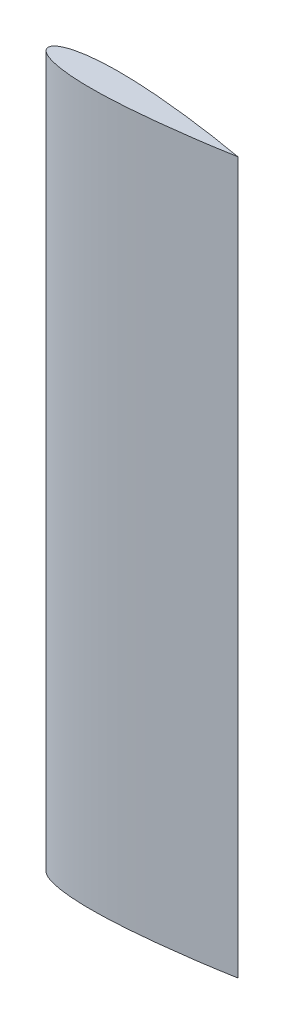
from build123d import *


with BuildPart() as part:
    # rootSketch → Loft1 section 0
    with BuildSketch(Plane(origin=(0, 0, 0), x_dir=(1, 0, 0), z_dir=(0, 1, 0))):
        with BuildLine():
            add(Edge.make_bspline(
                [(0, 0), (-1.6572e-05, 0.056577364), (0.005364667, 0.148026672), (0.026073501, 0.280241396), (0.077769955, 0.452215412), (0.147060273, 0.611874915), (0.248525433, 0.785971359), (0.39236103, 0.977542518), (0.599181982, 1.195423819), (0.905829823, 1.451816919), (1.370469676, 1.757918922), (2.078266075, 2.119108524), (3.175731681, 2.542039428), (4.823252293, 2.99869744), (7.275411011, 3.452976612), (10.438659341, 3.780475746), (14.129329887, 3.929259057), (18.143568779, 3.896250983), (22.151742679, 3.722301475), (25.656241741, 3.475962342), (28.651461505, 3.213566971), (31.650711737, 2.914013348), (34.134157887, 2.639630917), (36.639458817, 2.336640809), (39.599525944, 1.953685828), (42.127939329, 1.60070159), (44.533194308, 1.24753169), (47.121130826, 0.837424538), (48.910319544, 0.545474341), (50.6553202, 0.241362714), (51.550989041, 0.081579679), (52, 0)],
                knots=[0, 0, 0, 0, 0, 0.003840944, 0.006235023, 0.009072291, 0.01219322, 0.015656839, 0.019917177, 0.025338962, 0.032592504, 0.042799388, 0.05770457, 0.079310668, 0.112503101, 0.158972616, 0.227236465, 0.295500326, 0.36376419, 0.432028053, 0.500291915, 0.534423847, 0.56855578, 0.636819643, 0.670951575, 0.705083508, 0.773347371, 0.807479302, 0.841611234, 0.875743167, 0.9098751, 0.9098751, 0.9098751, 0.9098751, 0.9098751], degree=4))
            add(Edge.make_bspline(
                [(0, 0), (-1.6572e-05, -0.056577364), (0.005364667, -0.148026672), (0.026073501, -0.280241396), (0.077769955, -0.452215412), (0.147060273, -0.611874915), (0.248525433, -0.785971359), (0.39236103, -0.977542518), (0.599181982, -1.195423819), (0.905829823, -1.451816919), (1.370469676, -1.757918922), (2.078266075, -2.119108524), (3.175731681, -2.542039428), (4.823252293, -2.99869744), (7.275411011, -3.452976612), (10.438659341, -3.780475746), (14.129329887, -3.929259057), (18.143568779, -3.896250983), (22.151742679, -3.722301475), (25.656241741, -3.475962342), (28.651461505, -3.213566971), (31.650711737, -2.914013348), (34.134157887, -2.639630917), (36.639458817, -2.336640809), (39.599525944, -1.953685828), (42.127939329, -1.60070159), (44.533194308, -1.24753169), (47.121130826, -0.837424538), (48.910319544, -0.545474341), (50.6553202, -0.241362714), (51.550989041, -0.081579679), (52, 0)],
                knots=[0, 0, 0, 0, 0, 0.003840944, 0.006235023, 0.009072291, 0.01219322, 0.015656839, 0.019917177, 0.025338962, 0.032592504, 0.042799388, 0.05770457, 0.079310668, 0.112503101, 0.158972616, 0.227236465, 0.295500326, 0.36376419, 0.432028053, 0.500291915, 0.534423847, 0.56855578, 0.636819643, 0.670951575, 0.705083508, 0.773347371, 0.807479302, 0.841611234, 0.875743167, 0.9098751, 0.9098751, 0.9098751, 0.9098751, 0.9098751], degree=4))
        make_face()
    # tipSketch → Loft1 section 1
    with BuildSketch(Plane(origin=(0, 195, 0), x_dir=(1, 0, 0), z_dir=(0, 1, 0))):
        with BuildLine():
            add(Edge.make_bspline(
                [(0, 0), (-1.6572e-05, 0.056577364), (0.005364667, 0.148026672), (0.026073501, 0.280241396), (0.077769955, 0.452215412), (0.147060273, 0.611874915), (0.248525433, 0.785971359), (0.39236103, 0.977542518), (0.599181982, 1.195423819), (0.905829823, 1.451816919), (1.370469676, 1.757918922), (2.078266075, 2.119108524), (3.175731681, 2.542039428), (4.823252293, 2.99869744), (7.275411011, 3.452976612), (10.438659341, 3.780475746), (14.129329887, 3.929259057), (18.143568779, 3.896250983), (22.151742679, 3.722301475), (25.656241741, 3.475962342), (28.651461505, 3.213566971), (31.650711737, 2.914013348), (34.134157887, 2.639630917), (36.639458817, 2.336640809), (39.599525944, 1.953685828), (42.127939329, 1.60070159), (44.533194308, 1.24753169), (47.121130826, 0.837424538), (48.910319544, 0.545474341), (50.6553202, 0.241362714), (51.550989041, 0.081579679), (52, 0)],
                knots=[0, 0, 0, 0, 0, 0.003840944, 0.006235023, 0.009072291, 0.01219322, 0.015656839, 0.019917177, 0.025338962, 0.032592504, 0.042799388, 0.05770457, 0.079310668, 0.112503101, 0.158972616, 0.227236465, 0.295500326, 0.36376419, 0.432028053, 0.500291915, 0.534423847, 0.56855578, 0.636819643, 0.670951575, 0.705083508, 0.773347371, 0.807479302, 0.841611234, 0.875743167, 0.9098751, 0.9098751, 0.9098751, 0.9098751, 0.9098751], degree=4))
            add(Edge.make_bspline(
                [(0, 0), (-1.6572e-05, -0.056577364), (0.005364667, -0.148026672), (0.026073501, -0.280241396), (0.077769955, -0.452215412), (0.147060273, -0.611874915), (0.248525433, -0.785971359), (0.39236103, -0.977542518), (0.599181982, -1.195423819), (0.905829823, -1.451816919), (1.370469676, -1.757918922), (2.078266075, -2.119108524), (3.175731681, -2.542039428), (4.823252293, -2.99869744), (7.275411011, -3.452976612), (10.438659341, -3.780475746), (14.129329887, -3.929259057), (18.143568779, -3.896250983), (22.151742679, -3.722301475), (25.656241741, -3.475962342), (28.651461505, -3.213566971), (31.650711737, -2.914013348), (34.134157887, -2.639630917), (36.639458817, -2.336640809), (39.599525944, -1.953685828), (42.127939329, -1.60070159), (44.533194308, -1.24753169), (47.121130826, -0.837424538), (48.910319544, -0.545474341), (50.6553202, -0.241362714), (51.550989041, -0.081579679), (52, 0)],
                knots=[0, 0, 0, 0, 0, 0.003840944, 0.006235023, 0.009072291, 0.01219322, 0.015656839, 0.019917177, 0.025338962, 0.032592504, 0.042799388, 0.05770457, 0.079310668, 0.112503101, 0.158972616, 0.227236465, 0.295500326, 0.36376419, 0.432028053, 0.500291915, 0.534423847, 0.56855578, 0.636819643, 0.670951575, 0.705083508, 0.773347371, 0.807479302, 0.841611234, 0.875743167, 0.9098751, 0.9098751, 0.9098751, 0.9098751, 0.9098751], degree=4))
        make_face()
    loft()


solid = part.part
